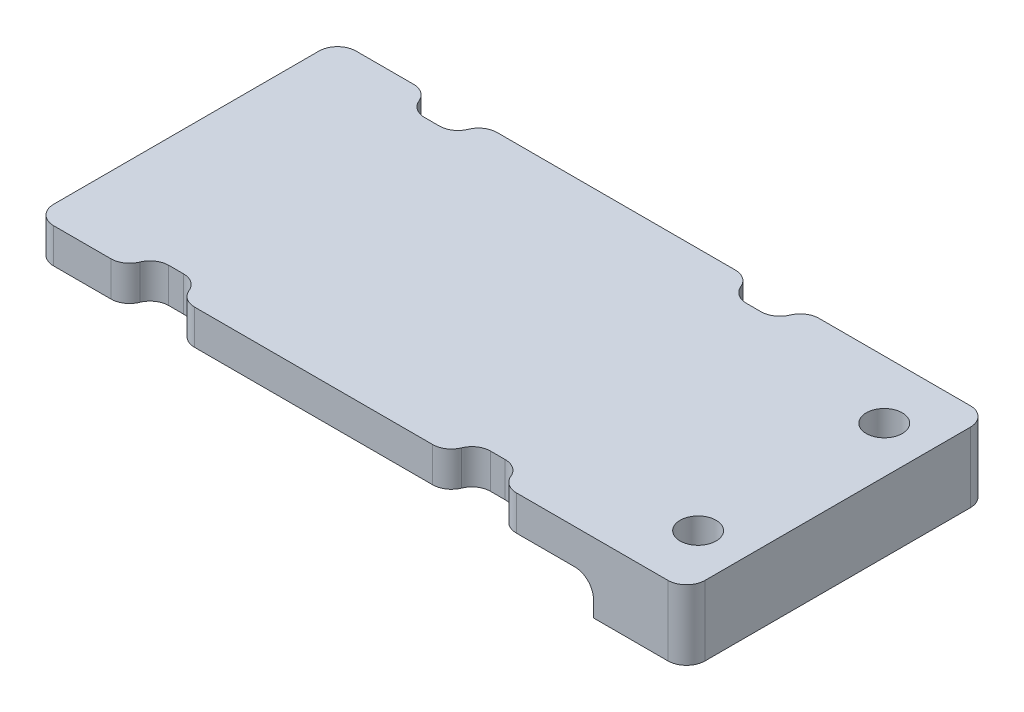
from build123d import *

# Parameters (mm, degrees)
SKETCH1_W                    = 88.9
SKETCH1_H                    = 41.275
BOSS_EXTRUDE1_DEPTH          = 4.7625
SKETCH3_W                    = 12.7
SKETCH3_H                    = 41.275
BOSS_EXTRUDE2_DEPTH          = 4.7625
F_10_0_1935_DIAMETER_HOLE1_D = 4.9149
SKETCH9_W                    = 6.35
SKETCH9_H                    = 3.175
CUT_EXTRUDE1_DEPTH           = 50.924287989
FILLET1_R                    = 2.54
FILLET2_R                    = 2.54


with BuildPart() as part:
    # Sketch1 → Boss-Extrude1 (new body)
    with BuildSketch(Plane(origin=(0, 0, 0), x_dir=(1, 0, 0), z_dir=(0, 1, 0))):
        Rectangle(SKETCH1_W, SKETCH1_H)
    extrude(amount=BOSS_EXTRUDE1_DEPTH)

    # Sketch3 → Boss-Extrude2 (add)
    with BuildSketch(Plane.XZ):
        with Locations((38.1, 0)):
            Rectangle(SKETCH3_W, SKETCH3_H)
    extrude(amount=BOSS_EXTRUDE2_DEPTH)

    # #10 (0.1935) Diameter Hole1 (through all)
    with Locations(Plane(origin=(0, 4.7625, 0), x_dir=(1, 0, 0), z_dir=(0, 1, 0))):
        with Locations((38.1, 12.7), (38.1, -12.7)):
            Hole(F_10_0_1935_DIAMETER_HOLE1_D / 2)

    # Sketch9 → Cut-Extrude1 (cut, through all)
    with BuildSketch(Plane(origin=(0, 4.7625, 0), x_dir=(1, 0, 0), z_dir=(0, 1, 0))):
        with Locations((15.534707564, 19.05)):
            Rectangle(SKETCH9_W, SKETCH9_H)
        with Locations((-28.3765625, 19.05)):
            Rectangle(SKETCH9_W, SKETCH9_H)
        with Locations((-28.3765625, -19.05)):
            Rectangle(SKETCH9_W, SKETCH9_H)
        with Locations((15.534707564, -19.05)):
            Rectangle(SKETCH9_W, SKETCH9_H)
    extrude(amount=-CUT_EXTRUDE1_DEPTH, mode=Mode.SUBTRACT)

    # Fillet1
    fillet1_edges = [part.edges().sort_by_distance(p)[0] for p in [
        (31.75, 0, 0),
        (-25.2015625, 2.38125, 20.6375),
        (-31.5515625, 2.38125, 20.6375),
        (-44.45, 2.38125, 20.6375),
        (-31.5515625, 2.38125, -20.6375),
        (-25.2015625, 2.38125, -20.6375),
        (12.359707564, 2.38125, -20.6375),
        (18.709707564, 2.38125, -20.6375),
        (44.45, 0, -20.6375),
        (44.45, 0, 20.6375),
        (18.709707564, 2.38125, 20.6375),
        (12.359707564, 2.38125, 20.6375),
        (-44.45, 2.38125, -20.6375),
    ]]
    fillet(fillet1_edges, radius=FILLET1_R)

    # Fillet2
    fillet2_edges = [part.edges().sort_by_distance(p)[0] for p in [
        (18.709707564, 2.38125, -17.4625),
        (12.359707564, 2.38125, -17.4625),
        (-31.5515625, 2.38125, -17.4625),
        (-25.2015625, 2.38125, -17.4625),
        (-25.2015625, 2.38125, 17.4625),
        (-31.5515625, 2.38125, 17.4625),
        (12.359707564, 2.38125, 17.4625),
        (18.709707564, 2.38125, 17.4625),
    ]]
    fillet(fillet2_edges, radius=FILLET2_R)


solid = part.part
